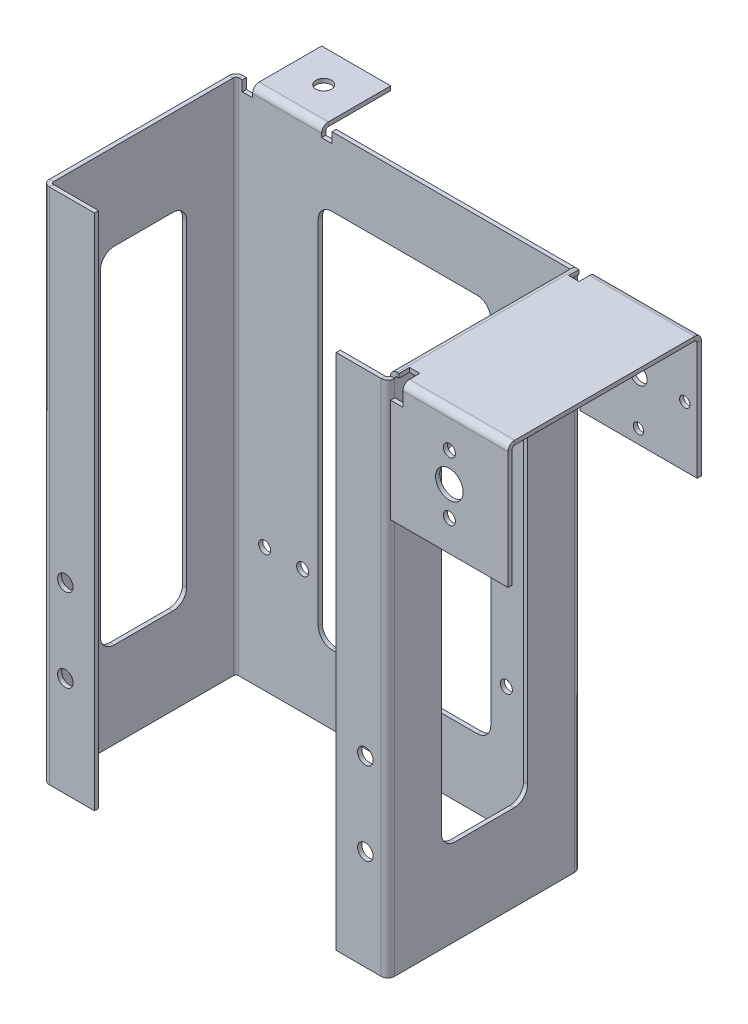
from build123d import *

# Parameters (mm, degrees)
SKETCH_1_W                         = 100
SKETCH_1_H                         = 150
SM_BASE_FLANGE_1_DEPTH             = 1.2
SM_EDGE_FLANGE_1_STRIP_W           = 6.2732
SM_EDGE_FLANGE_1_STRIP_H           = 1.2
SM_EDGE_FLANGE_1_STRIP_CUT_DEPTH   = 150
SM_EDGE_FLANGE_1_STRIP_2_W         = 6.2732
SM_EDGE_FLANGE_1_STRIP_2_H         = 1.2
SM_EDGE_FLANGE_1_STRIP_CUT_2_DEPTH = 150
SM_EDGE_FLANGE_1_DEPTH             = 150
SM_EDGE_FLANGE_1_BEND_DEPTH        = 150
SM_EDGE_FLANGE_2_STRIP_W           = 6.2732
SM_EDGE_FLANGE_2_STRIP_H           = 1.2
SM_EDGE_FLANGE_2_STRIP_CUT_DEPTH   = 150
SM_EDGE_FLANGE_2_STRIP_2_W         = 6.2732
SM_EDGE_FLANGE_2_STRIP_2_H         = 1.2
SM_EDGE_FLANGE_2_STRIP_CUT_2_DEPTH = 150
SM_EDGE_FLANGE_2_DEPTH             = 150
SM_EDGE_FLANGE_2_BEND_DEPTH        = 150
CUT_EXTRUDE_1_REACH                = 190.775
CUT_EXTRUDE_2_DEPTH                = 189.422503964
CUT_EXTRUDE_3_REACH                = 190.775
SKETCH_21_R                        = 2.25
CUT_EXTRUDE_4_REACH                = 190.423
SKETCH_22_R                        = 1.75
SM_EDGE_FLANGE_3_DEPTH             = 52.1268
CUT_EXTRUDE_5_REACH                = 212.378
SKETCH_26_W                        = 3
SKETCH_26_H                        = 3
SM_EDGE_FLANGE_4_DEPTH             = 30.5
SM_EDGE_FLANGE_4_BEND_DEPTH        = 30.5
SKETCH_33_W                        = 3.5
SKETCH_33_H                        = 1.2
EXTRUDE_1_DEPTH                    = 30
CUT_EXTRUDE_6_REACH                = 212.694
SKETCH_34_R                        = 2.5
SKETCH_34_R_2                      = 1.5
CUT_EXTRUDE_7_REACH                = 212.378
SKETCH_35_R                        = 4
SKETCH_35_R_2                      = 1.75
CUT_EXTRUDE_8_REACH                = 212.694
SKETCH_36_W                        = 3
SKETCH_36_H                        = 3
SM_EDGE_FLANGE_5_STRIP_W           = 6.2732
SM_EDGE_FLANGE_5_STRIP_H           = 1.2
SM_EDGE_FLANGE_5_STRIP_CUT_DEPTH   = 20
SM_EDGE_FLANGE_5_DEPTH             = 20
CUT_EXTRUDE_9_REACH                = 210.983
SKETCH_40_R                        = 2.25


# Sheet-metal steps are written as plain solids
with BuildPart() as part:
    # Sketch 1 → Базовая кромка1 (new body)
    with BuildSketch(Plane.XY):
        with Locations((50, 75)):
            Rectangle(SKETCH_1_W, SKETCH_1_H)
    extrude(amount=-SM_BASE_FLANGE_1_DEPTH)

    # Ребро-кромка1 strip (across the edge) → Ребро-кромка1 strip cut (cut)
    with BuildSketch(Plane(origin=(100, 0, 0), x_dir=(-1, 0, 0), z_dir=(0, 1, 0))):
        with Locations((-1.2, -0.6)):
            Rectangle(SM_EDGE_FLANGE_1_STRIP_W, SM_EDGE_FLANGE_1_STRIP_H)
    extrude(amount=SM_EDGE_FLANGE_1_STRIP_CUT_DEPTH, mode=Mode.SUBTRACT)

    # Ребро-кромка1 strip 2 (across the edge) → Ребро-кромка1 strip cut 2 (cut)
    with BuildSketch(Plane.XZ.offset(-150)):
        with Locations((-1.2, -0.6)):
            Rectangle(SM_EDGE_FLANGE_1_STRIP_2_W, SM_EDGE_FLANGE_1_STRIP_2_H)
    extrude(amount=SM_EDGE_FLANGE_1_STRIP_CUT_2_DEPTH, mode=Mode.SUBTRACT)

    # Ребро-кромка1 section (across the edge) → Ребро-кромка1 (add)
    with BuildSketch(Plane(origin=(100, 0, 0), x_dir=(-1, 0, 0), z_dir=(0, 1, 0))):
        with BuildLine():
            Line((0, 0.7366), (0, 54.8))
            Line((0, 54.8), (1.2, 54.8))
            Line((1.2, 54.8), (1.2, 0.7366))
            ThreePointArc((1.2, 0.7366), (1.415745145, 0.215745145), (1.9366, 0))
            Line((1.9366, 0), (1.9366, -1.2))
            ThreePointArc((1.9366, -1.2), (0.567217008, -0.632782992), (0, 0.7366))
        make_face()
    extrude(amount=SM_EDGE_FLANGE_1_DEPTH)

    # Ребро-кромка1 section 2 (across the edge) → Ребро-кромка1 bend (add)
    with BuildSketch(Plane.XZ.offset(-150)):
        with BuildLine():
            Line((0, 0.7366), (0, 54.8))
            Line((0, 54.8), (1.2, 54.8))
            Line((1.2, 54.8), (1.2, 0.7366))
            ThreePointArc((1.2, 0.7366), (1.415745145, 0.215745145), (1.9366, 0))
            Line((1.9366, 0), (1.9366, -1.2))
            ThreePointArc((1.9366, -1.2), (0.567217008, -0.632782992), (0, 0.7366))
        make_face()
    extrude(amount=SM_EDGE_FLANGE_1_BEND_DEPTH)

    # Ребро-кромка2 strip (across the edge) → Ребро-кромка2 strip cut (cut)
    with BuildSketch(Plane(origin=(1.2, 150, 54.8), x_dir=(0, 0, -1), z_dir=(0, -1, 0))):
        with Locations((-1.2, -0.6)):
            Rectangle(SM_EDGE_FLANGE_2_STRIP_W, SM_EDGE_FLANGE_2_STRIP_H)
    extrude(amount=SM_EDGE_FLANGE_2_STRIP_CUT_DEPTH, mode=Mode.SUBTRACT)

    # Ребро-кромка2 strip 2 (across the edge) → Ребро-кромка2 strip cut 2 (cut)
    with BuildSketch(Plane(origin=(98.8, 0, 54.8), x_dir=(0, 0, -1), z_dir=(0, 1, 0))):
        with Locations((-1.2, -0.6)):
            Rectangle(SM_EDGE_FLANGE_2_STRIP_2_W, SM_EDGE_FLANGE_2_STRIP_2_H)
    extrude(amount=SM_EDGE_FLANGE_2_STRIP_CUT_2_DEPTH, mode=Mode.SUBTRACT)

    # Ребро-кромка2 section (across the edge) → Ребро-кромка2 (add)
    with BuildSketch(Plane(origin=(1.2, 150, 54.8), x_dir=(0, 0, -1), z_dir=(0, -1, 0))):
        with BuildLine():
            Line((0, 0.7366), (0, 13.8))
            Line((0, 13.8), (1.2, 13.8))
            Line((1.2, 13.8), (1.2, 0.7366))
            ThreePointArc((1.2, 0.7366), (1.415745145, 0.215745145), (1.9366, 0))
            Line((1.9366, 0), (1.9366, -1.2))
            ThreePointArc((1.9366, -1.2), (0.567217008, -0.632782992), (0, 0.7366))
        make_face()
    extrude(amount=SM_EDGE_FLANGE_2_DEPTH)

    # Ребро-кромка2 section 2 (across the edge) → Ребро-кромка2 bend (add)
    with BuildSketch(Plane(origin=(98.8, 0, 54.8), x_dir=(0, 0, -1), z_dir=(0, 1, 0))):
        with BuildLine():
            Line((0, 0.7366), (0, 13.8))
            Line((0, 13.8), (1.2, 13.8))
            Line((1.2, 13.8), (1.2, 0.7366))
            ThreePointArc((1.2, 0.7366), (1.415745145, 0.215745145), (1.9366, 0))
            Line((1.9366, 0), (1.9366, -1.2))
            ThreePointArc((1.9366, -1.2), (0.567217008, -0.632782992), (0, 0.7366))
        make_face()
    extrude(amount=SM_EDGE_FLANGE_2_BEND_DEPTH)

    # Эскиз19 → Вырез-Вытянуть1 (cut, up to next)
    with BuildSketch(Plane(origin=(0, 0, -1.2), x_dir=(-1, 0, 0), z_dir=(0, 0, -1)), mode=Mode.PRIVATE) as cut_extrude_1_sk1:
        with BuildLine():
            Line((-71, 130), (-29, 130))
            ThreePointArc((-29, 130), (-26.171572875, 128.828427125), (-25, 126))
            Line((-25, 126), (-25, 24))
            ThreePointArc((-25, 24), (-26.171572875, 21.171572875), (-29, 20))
            Line((-29, 20), (-71, 20))
            ThreePointArc((-71, 20), (-73.828427125, 21.171572875), (-75, 24))
            Line((-75, 24), (-75, 126))
            ThreePointArc((-75, 126), (-73.828427125, 128.828427125), (-71, 130))
        make_face()
    cut_extrude_1_tool1 = extrude(cut_extrude_1_sk1.sketch, amount=-CUT_EXTRUDE_1_REACH, mode=Mode.PRIVATE) & part.part
    add(cut_extrude_1_tool1.solids().sort_by_distance((50, 75, -1.2))[0], mode=Mode.SUBTRACT)

    # Эскиз20 → Вырез-Вытянуть2 (cut, through all)
    with BuildSketch(Plane(origin=(100, 0, 0), x_dir=(0, 0, -1), z_dir=(1, 0, 0))):
        with BuildLine():
            Line((-35.3, 125), (-18.3, 125))
            ThreePointArc((-18.3, 125), (-15.471572875, 123.828427125), (-14.3, 121))
            Line((-14.3, 121), (-14.3, 29))
            ThreePointArc((-14.3, 29), (-15.471572875, 26.171572875), (-18.3, 25))
            Line((-18.3, 25), (-35.3, 25))
            ThreePointArc((-35.3, 25), (-38.128427125, 26.171572875), (-39.3, 29))
            Line((-39.3, 29), (-39.3, 121))
            ThreePointArc((-39.3, 121), (-38.128427125, 123.828427125), (-35.3, 125))
        make_face()
    extrude(amount=-CUT_EXTRUDE_2_DEPTH, mode=Mode.SUBTRACT)

    # Эскиз21 → Вырез-Вытянуть3 (cut, up to next)
    with BuildSketch(Plane.XY.offset(54.8), mode=Mode.PRIVATE) as cut_extrude_3_sk1:
        with Locations((6.5317, 53)):
            Circle(SKETCH_21_R)
    cut_extrude_3_tool1 = extrude(cut_extrude_3_sk1.sketch, amount=-CUT_EXTRUDE_3_REACH, mode=Mode.PRIVATE) & part.part
    # Эскиз21 → Вырез-Вытянуть3 (cut, up to next)
    with BuildSketch(Plane.XY.offset(54.8), mode=Mode.PRIVATE) as cut_extrude_3_sk2:
        with Locations((6.5317, 29)):
            Circle(SKETCH_21_R)
    cut_extrude_3_tool2 = extrude(cut_extrude_3_sk2.sketch, amount=-CUT_EXTRUDE_3_REACH, mode=Mode.PRIVATE) & part.part
    # Эскиз21 → Вырез-Вытянуть3 (cut, up to next)
    with BuildSketch(Plane.XY.offset(54.8), mode=Mode.PRIVATE) as cut_extrude_3_sk3:
        with Locations((93.4683, 53)):
            Circle(SKETCH_21_R)
    cut_extrude_3_tool3 = extrude(cut_extrude_3_sk3.sketch, amount=-CUT_EXTRUDE_3_REACH, mode=Mode.PRIVATE) & part.part
    # Эскиз21 → Вырез-Вытянуть3 (cut, up to next)
    with BuildSketch(Plane.XY.offset(54.8), mode=Mode.PRIVATE) as cut_extrude_3_sk4:
        with Locations((93.4683, 29)):
            Circle(SKETCH_21_R)
    cut_extrude_3_tool4 = extrude(cut_extrude_3_sk4.sketch, amount=-CUT_EXTRUDE_3_REACH, mode=Mode.PRIVATE) & part.part
    add(cut_extrude_3_tool1.solids().sort_by_distance((6.5317, 53, 54.8))[0], mode=Mode.SUBTRACT)
    add(cut_extrude_3_tool2.solids().sort_by_distance((6.5317, 29, 54.8))[0], mode=Mode.SUBTRACT)
    add(cut_extrude_3_tool3.solids().sort_by_distance((93.4683, 53, 54.8))[0], mode=Mode.SUBTRACT)
    add(cut_extrude_3_tool4.solids().sort_by_distance((93.4683, 29, 54.8))[0], mode=Mode.SUBTRACT)

    # Эскиз22 → Вырез-Вытянуть4 (cut, up to next)
    with BuildSketch(Plane.XY, mode=Mode.PRIVATE) as cut_extrude_4_sk1:
        with Locations((90.5, 36)):
            Circle(SKETCH_22_R)
    cut_extrude_4_tool1 = extrude(cut_extrude_4_sk1.sketch, amount=-CUT_EXTRUDE_4_REACH, mode=Mode.PRIVATE) & part.part
    # Эскиз22 → Вырез-Вытянуть4 (cut, up to next)
    with BuildSketch(Plane.XY, mode=Mode.PRIVATE) as cut_extrude_4_sk2:
        with Locations((79.5, 36)):
            Circle(SKETCH_22_R)
    cut_extrude_4_tool2 = extrude(cut_extrude_4_sk2.sketch, amount=-CUT_EXTRUDE_4_REACH, mode=Mode.PRIVATE) & part.part
    # Эскиз22 → Вырез-Вытянуть4 (cut, up to next)
    with BuildSketch(Plane.XY, mode=Mode.PRIVATE) as cut_extrude_4_sk3:
        with Locations((20.5, 36)):
            Circle(SKETCH_22_R)
    cut_extrude_4_tool3 = extrude(cut_extrude_4_sk3.sketch, amount=-CUT_EXTRUDE_4_REACH, mode=Mode.PRIVATE) & part.part
    # Эскиз22 → Вырез-Вытянуть4 (cut, up to next)
    with BuildSketch(Plane.XY, mode=Mode.PRIVATE) as cut_extrude_4_sk4:
        with Locations((9.5, 36)):
            Circle(SKETCH_22_R)
    cut_extrude_4_tool4 = extrude(cut_extrude_4_sk4.sketch, amount=-CUT_EXTRUDE_4_REACH, mode=Mode.PRIVATE) & part.part
    add(cut_extrude_4_tool1.solids().sort_by_distance((90.5, 36, 0))[0], mode=Mode.SUBTRACT)
    add(cut_extrude_4_tool2.solids().sort_by_distance((79.5, 36, 0))[0], mode=Mode.SUBTRACT)
    add(cut_extrude_4_tool3.solids().sort_by_distance((20.5, 36, 0))[0], mode=Mode.SUBTRACT)
    add(cut_extrude_4_tool4.solids().sort_by_distance((9.5, 36, 0))[0], mode=Mode.SUBTRACT)

    # Ребро-кромка3 section (across the edge) → Ребро-кромка3 (add)
    with BuildSketch(Plane(origin=(100, 150.7366, 0.7366), x_dir=(0, -1, 0), z_dir=(0, 0, 1))):
        with BuildLine():
            Line((-1.2, 0.7366), (-1.2, 34.8))
            Line((-1.2, 34.8), (0, 34.8))
            Line((0, 34.8), (0, 0.7366))
            ThreePointArc((0, 0.7366), (0.215745145, 0.215745145), (0.7366, 0))
            Line((0.7366, 0), (0.7366, -1.2))
            ThreePointArc((0.7366, -1.2), (-0.632782992, -0.632782992), (-1.2, 0.7366))
        make_face()
    extrude(amount=SM_EDGE_FLANGE_3_DEPTH)

    # Эскиз26 → Вырез-Вытянуть5 (cut, up to next)
    with BuildSketch(Plane(origin=(0, 151.9366, 0), x_dir=(1, 0, 0), z_dir=(0, 1, 0)), mode=Mode.PRIVATE) as cut_extrude_5_sk1:
        with Locations((102.8, -51.3634)):
            Rectangle(SKETCH_26_W, SKETCH_26_H)
    cut_extrude_5_tool1 = extrude(cut_extrude_5_sk1.sketch, amount=-CUT_EXTRUDE_5_REACH, mode=Mode.PRIVATE) & part.part
    # Эскиз26 → Вырез-Вытянуть5 (cut, up to next)
    with BuildSketch(Plane(origin=(0, 151.9366, 0), x_dir=(1, 0, 0), z_dir=(0, 1, 0)), mode=Mode.PRIVATE) as cut_extrude_5_sk2:
        with Locations((102.8, -2.2366)):
            Rectangle(SKETCH_26_W, SKETCH_26_H)
    cut_extrude_5_tool2 = extrude(cut_extrude_5_sk2.sketch, amount=-CUT_EXTRUDE_5_REACH, mode=Mode.PRIVATE) & part.part
    add(cut_extrude_5_tool1.solids().sort_by_distance((102.8, 151.9366, 51.3634))[0], mode=Mode.SUBTRACT)
    add(cut_extrude_5_tool2.solids().sort_by_distance((102.8, 151.9366, 2.2366))[0], mode=Mode.SUBTRACT)

    # Ребро-кромка4 section (across the edge) → Ребро-кромка4 (add)
    with BuildSketch(Plane(origin=(134.8, 150.7366, 53.6), x_dir=(0, 0, -1), z_dir=(-1, 0, 0))):
        with BuildLine():
            Line((-1.2, 0.7366), (-1.2, 34.8))
            Line((-1.2, 34.8), (0, 34.8))
            Line((0, 34.8), (0, 0.7366))
            ThreePointArc((0, 0.7366), (0.215745145, 0.215745145), (0.7366, 0))
            Line((0.7366, 0), (0.7366, -1.2))
            ThreePointArc((0.7366, -1.2), (-0.632782992, -0.632782992), (-1.2, 0.7366))
        make_face()
    extrude(amount=SM_EDGE_FLANGE_4_DEPTH)

    # Ребро-кромка4 section 2 (across the edge) → Ребро-кромка4 bend (add)
    with BuildSketch(Plane(origin=(104.3, 150.7366, 0), x_dir=(0, 0, 1), z_dir=(1, 0, 0))):
        with BuildLine():
            Line((-1.2, 0.7366), (-1.2, 34.8))
            Line((-1.2, 34.8), (0, 34.8))
            Line((0, 34.8), (0, 0.7366))
            ThreePointArc((0, 0.7366), (0.215745145, 0.215745145), (0.7366, 0))
            Line((0.7366, 0), (0.7366, -1.2))
            ThreePointArc((0.7366, -1.2), (-0.632782992, -0.632782992), (-1.2, 0.7366))
        make_face()
    extrude(amount=SM_EDGE_FLANGE_4_BEND_DEPTH)

    # Эскиз33 → Бобышка-Вытянуть1 (add)
    with BuildSketch(Plane.XZ.offset(-115.9366)):
        with Locations((102.55, 54.2)):
            Rectangle(SKETCH_33_W, SKETCH_33_H)
        with Locations((102.55, -0.6)):
            Rectangle(SKETCH_33_W, SKETCH_33_H)
    extrude(amount=-EXTRUDE_1_DEPTH)

    # Эскиз34 → Вырез-Вытянуть6 (cut, up to next)
    with BuildSketch(Plane(origin=(0, 0, -1.2), x_dir=(-1, 0, 0), z_dir=(0, 0, -1)), mode=Mode.PRIVATE) as cut_extrude_6_sk1:
        with Locations((-117.8, 133.3366)):
            Circle(SKETCH_34_R)
    cut_extrude_6_tool1 = extrude(cut_extrude_6_sk1.sketch, amount=-CUT_EXTRUDE_6_REACH, mode=Mode.PRIVATE) & part.part
    # Эскиз34 → Вырез-Вытянуть6 (cut, up to next)
    with BuildSketch(Plane(origin=(0, 0, -1.2), x_dir=(-1, 0, 0), z_dir=(0, 0, -1)), mode=Mode.PRIVATE) as cut_extrude_6_sk2:
        with Locations((-117.8, 146.7366)):
            Circle(SKETCH_34_R_2)
    cut_extrude_6_tool2 = extrude(cut_extrude_6_sk2.sketch, amount=-CUT_EXTRUDE_6_REACH, mode=Mode.PRIVATE) & part.part
    # Эскиз34 → Вырез-Вытянуть6 (cut, up to next)
    with BuildSketch(Plane(origin=(0, 0, -1.2), x_dir=(-1, 0, 0), z_dir=(0, 0, -1)), mode=Mode.PRIVATE) as cut_extrude_6_sk3:
        with Locations((-131.2, 133.3366)):
            Circle(SKETCH_34_R_2)
    cut_extrude_6_tool3 = extrude(cut_extrude_6_sk3.sketch, amount=-CUT_EXTRUDE_6_REACH, mode=Mode.PRIVATE) & part.part
    # Эскиз34 → Вырез-Вытянуть6 (cut, up to next)
    with BuildSketch(Plane(origin=(0, 0, -1.2), x_dir=(-1, 0, 0), z_dir=(0, 0, -1)), mode=Mode.PRIVATE) as cut_extrude_6_sk4:
        with Locations((-117.8, 119.9366)):
            Circle(SKETCH_34_R_2)
    cut_extrude_6_tool4 = extrude(cut_extrude_6_sk4.sketch, amount=-CUT_EXTRUDE_6_REACH, mode=Mode.PRIVATE) & part.part
    # Эскиз34 → Вырез-Вытянуть6 (cut, up to next)
    with BuildSketch(Plane(origin=(0, 0, -1.2), x_dir=(-1, 0, 0), z_dir=(0, 0, -1)), mode=Mode.PRIVATE) as cut_extrude_6_sk5:
        with Locations((-104.4, 133.3366)):
            Circle(SKETCH_34_R_2)
    cut_extrude_6_tool5 = extrude(cut_extrude_6_sk5.sketch, amount=-CUT_EXTRUDE_6_REACH, mode=Mode.PRIVATE) & part.part
    add(cut_extrude_6_tool1.solids().sort_by_distance((117.8, 133.3366, -1.2))[0], mode=Mode.SUBTRACT)
    add(cut_extrude_6_tool2.solids().sort_by_distance((117.8, 146.7366, -1.2))[0], mode=Mode.SUBTRACT)
    add(cut_extrude_6_tool3.solids().sort_by_distance((131.2, 133.3366, -1.2))[0], mode=Mode.SUBTRACT)
    add(cut_extrude_6_tool4.solids().sort_by_distance((117.8, 119.9366, -1.2))[0], mode=Mode.SUBTRACT)
    add(cut_extrude_6_tool5.solids().sort_by_distance((104.4, 133.3366, -1.2))[0], mode=Mode.SUBTRACT)

    # Эскиз35 → Вырез-Вытянуть7 (cut, up to next)
    with BuildSketch(Plane(origin=(0, 0, 53.6), x_dir=(-1, 0, 0), z_dir=(0, 0, -1)), mode=Mode.PRIVATE) as cut_extrude_7_sk1:
        with Locations((-117.8, 133.3366)):
            Circle(SKETCH_35_R)
    cut_extrude_7_tool1 = extrude(cut_extrude_7_sk1.sketch, amount=-CUT_EXTRUDE_7_REACH, mode=Mode.PRIVATE) & part.part
    # Эскиз35 → Вырез-Вытянуть7 (cut, up to next)
    with BuildSketch(Plane(origin=(0, 0, 53.6), x_dir=(-1, 0, 0), z_dir=(0, 0, -1)), mode=Mode.PRIVATE) as cut_extrude_7_sk2:
        with Locations((-117.8, 141.8366)):
            Circle(SKETCH_35_R_2)
    cut_extrude_7_tool2 = extrude(cut_extrude_7_sk2.sketch, amount=-CUT_EXTRUDE_7_REACH, mode=Mode.PRIVATE) & part.part
    # Эскиз35 → Вырез-Вытянуть7 (cut, up to next)
    with BuildSketch(Plane(origin=(0, 0, 53.6), x_dir=(-1, 0, 0), z_dir=(0, 0, -1)), mode=Mode.PRIVATE) as cut_extrude_7_sk3:
        with Locations((-117.8, 124.8366)):
            Circle(SKETCH_35_R_2)
    cut_extrude_7_tool3 = extrude(cut_extrude_7_sk3.sketch, amount=-CUT_EXTRUDE_7_REACH, mode=Mode.PRIVATE) & part.part
    add(cut_extrude_7_tool1.solids().sort_by_distance((117.8, 133.3366, 53.6))[0], mode=Mode.SUBTRACT)
    add(cut_extrude_7_tool2.solids().sort_by_distance((117.8, 141.8366, 53.6))[0], mode=Mode.SUBTRACT)
    add(cut_extrude_7_tool3.solids().sort_by_distance((117.8, 124.8366, 53.6))[0], mode=Mode.SUBTRACT)

    # Эскиз36 → Вырез-Вытянуть8 (cut, up to next)
    with BuildSketch(Plane(origin=(0, 0, -1.2), x_dir=(-1, 0, 0), z_dir=(0, 0, -1)), mode=Mode.PRIVATE) as cut_extrude_8_sk1:
        with Locations((-4.5, 148.5)):
            Rectangle(SKETCH_36_W, SKETCH_36_H)
    cut_extrude_8_tool1 = extrude(cut_extrude_8_sk1.sketch, amount=-CUT_EXTRUDE_8_REACH, mode=Mode.PRIVATE) & part.part
    # Эскиз36 → Вырез-Вытянуть8 (cut, up to next)
    with BuildSketch(Plane(origin=(0, 0, -1.2), x_dir=(-1, 0, 0), z_dir=(0, 0, -1)), mode=Mode.PRIVATE) as cut_extrude_8_sk2:
        with Locations((-27.5, 148.5)):
            Rectangle(SKETCH_36_W, SKETCH_36_H)
    cut_extrude_8_tool2 = extrude(cut_extrude_8_sk2.sketch, amount=-CUT_EXTRUDE_8_REACH, mode=Mode.PRIVATE) & part.part
    add(cut_extrude_8_tool1.solids().sort_by_distance((4.5, 148.5, -1.2))[0], mode=Mode.SUBTRACT)
    add(cut_extrude_8_tool2.solids().sort_by_distance((27.5, 148.5, -1.2))[0], mode=Mode.SUBTRACT)

    # Ребро-кромка5 strip (across the edge) → Ребро-кромка5 strip cut (cut)
    with BuildSketch(Plane(origin=(6, 150, -1.2), x_dir=(0, -1, 0), z_dir=(1, 0, 0))):
        with Locations((-1.2, -0.6)):
            Rectangle(SM_EDGE_FLANGE_5_STRIP_W, SM_EDGE_FLANGE_5_STRIP_H)
    extrude(amount=SM_EDGE_FLANGE_5_STRIP_CUT_DEPTH, mode=Mode.SUBTRACT)

    # Ребро-кромка5 section (across the edge) → Ребро-кромка5 (add)
    with BuildSketch(Plane(origin=(6, 150, -1.2), x_dir=(0, -1, 0), z_dir=(1, 0, 0))):
        with BuildLine():
            Line((0, 0.7366), (0, 18.8))
            Line((0, 18.8), (1.2, 18.8))
            Line((1.2, 18.8), (1.2, 0.7366))
            ThreePointArc((1.2, 0.7366), (1.415745145, 0.215745145), (1.9366, 0))
            Line((1.9366, 0), (1.9366, -1.2))
            ThreePointArc((1.9366, -1.2), (0.567217008, -0.632782992), (0, 0.7366))
        make_face()
    extrude(amount=SM_EDGE_FLANGE_5_DEPTH)

    # Эскиз40 → Вырез-Вытянуть9 (cut, up to next)
    with BuildSketch(Plane(origin=(0, 150, 0), x_dir=(1, 0, 0), z_dir=(0, 1, 0)), mode=Mode.PRIVATE) as cut_extrude_9_sk1:
        with Locations(Location((16, 10.6, 0), (0, 0, 270))):
            Circle(SKETCH_40_R)
    cut_extrude_9_tool1 = extrude(cut_extrude_9_sk1.sketch, amount=-CUT_EXTRUDE_9_REACH, mode=Mode.PRIVATE) & part.part
    add(cut_extrude_9_tool1.solids().sort_by_distance((16, 150, -10.6))[0], mode=Mode.SUBTRACT)


solid = part.part
